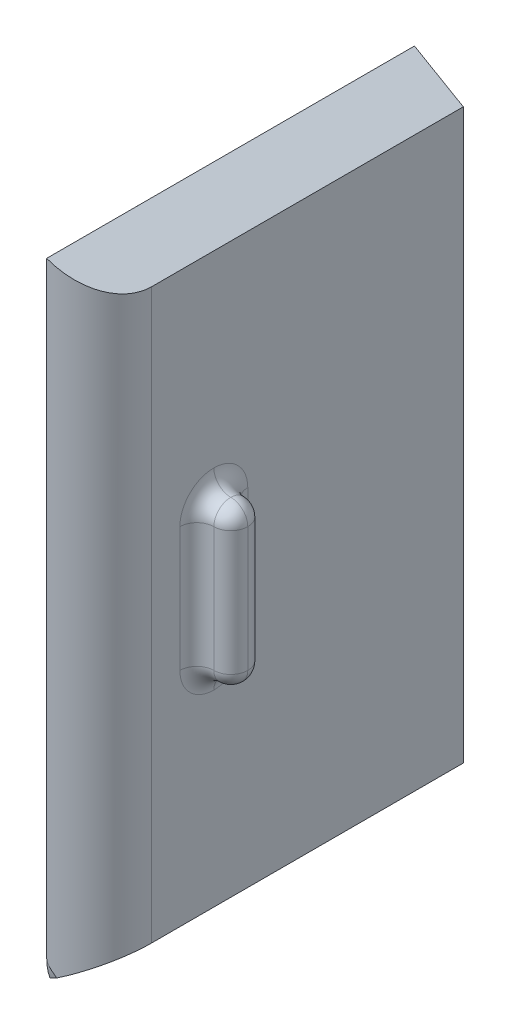
from build123d import *

# Parameters (mm, degrees)
BOSS_EXTRUDE1_DEPTH = 32.5
FILLET1_R           = 5
BOSS_EXTRUDE2_DEPTH = 3
FILLET2_R           = 1.5
FILLET3_R           = 1.5
CUT_EXTRUDE1_REACH  = 51.168


# Some blends are built 0.0001 mm under size
with BuildPart() as part:
    # Sketch1 → Boss-Extrude1 (new body)
    with BuildSketch(Plane.XY):
        Polygon((7.518400000000005, 16.559701585568554), (7.518400000000011, -33.66819896343934), (3.199999999999987, -36.16142836590783), (3.1999999999999793, 19.05293098803705), align=None)
    extrude(amount=-BOSS_EXTRUDE1_DEPTH)

    # Fillet1
    # the kernel refuses this fillet: 5 mm, written as the material it takes off along each edge
    with BuildSketch(Plane(origin=(7.518400000000003, 28.94301228989969, 0), x_dir=(0, 0, -1), z_dir=(1.2e-16, -1, 0))) as fillet1_piece_1:
        with BuildLine():
            CenterArc((4.953324281732454, -5), FILLET1_R, 90, 82.16504398350045)
            Line((2.931e-14, -4.318400000000029), (-0.09906648563461919, -4.3047680000000295))
            ThreePointArc((-0.09906648563461919, -4.3047680000000295), (-0.1, -2.1592000000000144), (-0.1, 0))
            Line((-0.1, 0), (0, 0.09999999999999964))
            Line((0, 0.09999999999999964), (4.953324281732454, 0.09999999999999964))
            Line((4.953324281732454, 0.09999999999999964), (4.953324281732454, 0))
        make_face()
    extrude(amount=74.99452195767016, mode=Mode.SUBTRACT)

    # Sketch3 → Boss-Extrude2 (add)
    with BuildSketch(Plane(origin=(7.518400000000007, 9.1e-16, 0), x_dir=(0, 0, -1), z_dir=(1, 1.2e-16, 0))):
        Polygon((8.953324281732419, -1.5542486889353926), (11.953324281732419, -1.554248688935389), (11.95332428173242, -15.55424868893539), (8.95332428173242, -15.55424868893539), align=None)
    extrude(amount=BOSS_EXTRUDE2_DEPTH)

    # Fillet2
    fillet2_edges = [part.edges().sort_by_distance(p)[0] for p in [
        (10.518400000000009, -8.55424868893539, -8.95332428173242),
        (10.518400000000009, -15.554248688935388, -10.45332428173242),
        (10.518400000000009, -8.554248688935386, -11.95332428173242),
        (10.518400000000007, -1.5542486889353895, -10.453324281732419),
    ]]
    fillet(fillet2_edges, radius=FILLET2_R - 0.0001)  # a hair under: the kernel refuses the full size

    # Fillet3
    # the kernel refuses this fillet: 1.5 mm, written as the material it takes off along each edge
    with BuildSketch(Plane(origin=(10.518400000000009, -14.05424868893539, -10.45332428173242), x_dir=(1.2e-16, -1, 0), z_dir=(0, 0, 1))) as fillet3_piece_1:
        with BuildLine():
            CenterArc((9.999999999999e-05, -1.4999), 1.4999, 0, 90)
            Line((1.5, -1.4999), (1.5, 0))
            Line((1.5, 0), (9.999999999999e-05, 0))
        make_face()
    revolve(axis=Axis((10.518400000000009, -14.05424868893539, -10.45332428173242), (1, 1.2e-16, 0)), revolution_arc=90.00000000000001, mode=Mode.SUBTRACT)
    with BuildSketch(Plane(origin=(10.518400000000009, -14.054248688935388, -10.45332428173242), x_dir=(0, -1.3e-16, 1), z_dir=(-1.2e-16, 1, 1.3e-16))) as fillet3_piece_2:
        with BuildLine():
            CenterArc((9.999999999999e-05, -1.4999), 1.4999, 0, 90)
            Line((1.5, -1.4999), (1.5, 0))
            Line((1.5, 0), (9.999999999999e-05, 0))
        make_face()
    revolve(axis=Axis((10.518400000000009, -14.054248688935388, -10.45332428173242), (1, 1.2e-16, 0)), revolution_arc=90, mode=Mode.SUBTRACT)
    with BuildSketch(Plane(origin=(10.518400000000009, -3.05424868893539, -10.453324281732419), x_dir=(0, 1.3e-16, -1), z_dir=(1.2e-16, -1, -1.3e-16))) as fillet3_piece_3:
        with BuildLine():
            CenterArc((9.999999999999e-05, -1.4999), 1.4999, 0, 90)
            Line((1.5, -1.4999), (1.5, 0))
            Line((1.5, 0), (9.999999999999e-05, 0))
        make_face()
    revolve(axis=Axis((10.518400000000009, -3.05424868893539, -10.453324281732419), (1, 1.2e-16, 0)), revolution_arc=90.00000000000006, mode=Mode.SUBTRACT)
    with BuildSketch(Plane(origin=(10.518400000000009, -3.05424868893539, -10.453324281732419), x_dir=(-1.2e-16, 1, 1.18e-15), z_dir=(0, 1.18e-15, -1))) as fillet3_piece_4:
        with BuildLine():
            CenterArc((9.999999999999e-05, -1.4999), 1.4999, 0, 90)
            Line((1.5, -1.4999), (1.5, 0))
            Line((1.5, 0), (9.999999999999e-05, 0))
        make_face()
    revolve(axis=Axis((10.518400000000009, -3.05424868893539, -10.453324281732419), (1, 1.2e-16, 0)), revolution_arc=89.99999999999994, mode=Mode.SUBTRACT)
    with BuildSketch(Plane(origin=(7.518400000000007, -1.5542486889353917, -8.953324281732419), x_dir=(0, 1.18e-15, -1), z_dir=(1, 1.2e-16, 0))) as fillet3_piece_5:
        with BuildLine():
            CenterArc((FILLET3_R, -FILLET3_R), FILLET3_R, 90, 89.99999999999986)
            Line((-1.78e-15, -FILLET3_R), (-FILLET3_R * 0.02, -FILLET3_R))
            Line((-FILLET3_R * 0.02, -FILLET3_R), (-FILLET3_R * 0.02, FILLET3_R * 0.02))
            Line((-FILLET3_R * 0.02, FILLET3_R * 0.02), (FILLET3_R, FILLET3_R * 0.02))
            Line((FILLET3_R, FILLET3_R * 0.02), (FILLET3_R, 0))
        make_face()
    extrude(amount=3, mode=Mode.SUBTRACT)
    with BuildSketch(Plane(origin=(7.518400000000007, -1.5542486889353881, -11.953324281732419), x_dir=(0, -1.18e-15, 1), z_dir=(1, 1.2e-16, 0))) as fillet3_piece_6:
        with BuildLine():
            CenterArc((FILLET3_R, FILLET3_R), FILLET3_R, 179.99999999999994, 90.00000000000006)
            Line((1.78e-15, FILLET3_R), (-FILLET3_R * 0.02, FILLET3_R))
            Line((-FILLET3_R * 0.02, FILLET3_R), (-FILLET3_R * 0.02, -FILLET3_R * 0.02))
            Line((-FILLET3_R * 0.02, -FILLET3_R * 0.02), (FILLET3_R, -FILLET3_R * 0.02))
            Line((FILLET3_R, -FILLET3_R * 0.02), (FILLET3_R, 0))
        make_face()
    extrude(amount=3, mode=Mode.SUBTRACT)
    with BuildSketch(Plane(origin=(7.518400000000009, -15.554248688935388, -11.95332428173242), x_dir=(-1.2e-16, 1, 0), z_dir=(1, 1.2e-16, 0))) as fillet3_piece_7:
        with BuildLine():
            CenterArc((FILLET3_R, FILLET3_R), FILLET3_R, 180, 90)
            Line((-1.78e-15, FILLET3_R), (-FILLET3_R * 0.02, FILLET3_R))
            Line((-FILLET3_R * 0.02, FILLET3_R), (-FILLET3_R * 0.02, -FILLET3_R * 0.02))
            Line((-FILLET3_R * 0.02, -FILLET3_R * 0.02), (FILLET3_R, -FILLET3_R * 0.02))
            Line((FILLET3_R, -FILLET3_R * 0.02), (FILLET3_R, 0))
        make_face()
    extrude(amount=3, mode=Mode.SUBTRACT)
    with BuildSketch(Plane(origin=(7.518400000000009, -15.554248688935388, -8.95332428173242), x_dir=(-1.2e-16, 1, 0), z_dir=(1, 1.2e-16, 0))) as fillet3_piece_8:
        with BuildLine():
            CenterArc((FILLET3_R, -FILLET3_R), FILLET3_R, 90, 90)
            Line((0, -FILLET3_R), (-FILLET3_R * 0.02, -FILLET3_R))
            Line((-FILLET3_R * 0.02, -FILLET3_R), (-FILLET3_R * 0.02, FILLET3_R * 0.02))
            Line((-FILLET3_R * 0.02, FILLET3_R * 0.02), (FILLET3_R, FILLET3_R * 0.02))
            Line((FILLET3_R, FILLET3_R * 0.02), (FILLET3_R, 0))
        make_face()
    extrude(amount=3, mode=Mode.SUBTRACT)
    fillet3_2_edges = [part.edges().sort_by_distance(p)[0] for p in [
        (7.518400000000008, -8.554248688935388, -8.953324281732419),
        (7.518400000000008, -8.55424868893539, -11.95332428173242),
    ]]
    fillet(fillet3_2_edges, radius=FILLET3_R)

    # Sketch4 → Cut-Extrude1 (cut, up to next)
    with BuildSketch(Plane.ZY.offset(-3.199999999999982), mode=Mode.PRIVATE) as cut_extrude1_sk1:
        with BuildLine():
            Line((-0.28410604604419637, -36.161428365907824), (0, -36.16142836590783))
            Line((0, -36.16142836590783), (6.94e-15, -34.499999999999986))
            ThreePointArc((6.94e-15, -34.499999999999986), (-0.07153828412053453, -35.34277227951001), (-0.28410604604419637, -36.161428365907824))
        make_face()
    cut_extrude1_tool1 = extrude(cut_extrude1_sk1.sketch, amount=-CUT_EXTRUDE1_REACH, mode=Mode.PRIVATE) & part.part
    add(cut_extrude1_tool1.solids().sort_by_distance((3.2, -35.748468, -0.0848))[0], mode=Mode.SUBTRACT)


solid = part.part
